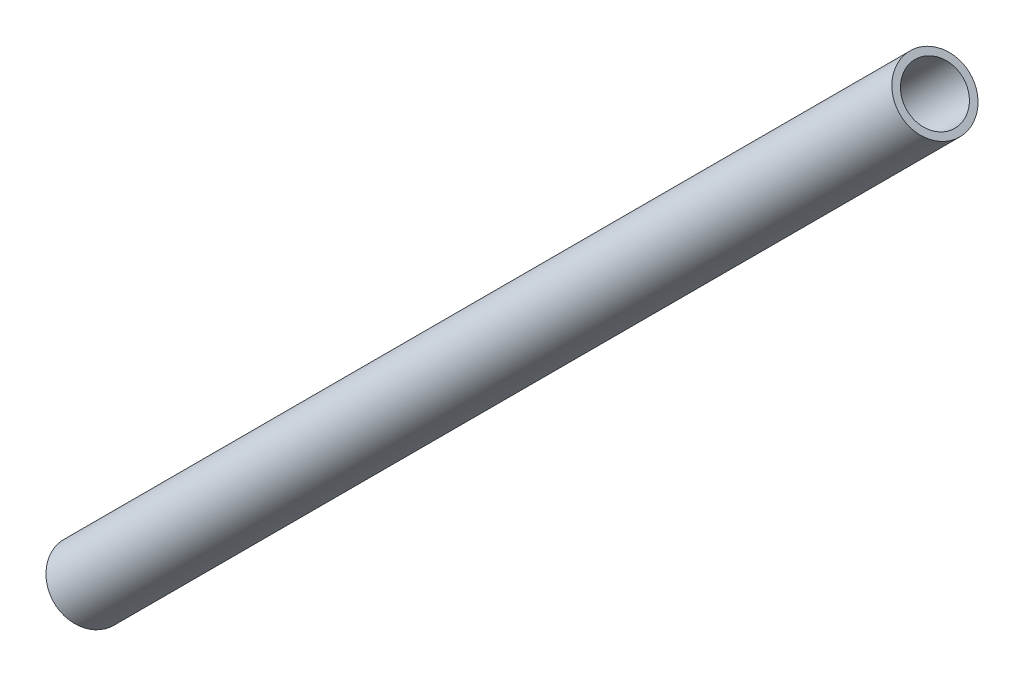
from build123d import *

# Parameters (mm, degrees)
SKETCH2_R           = 5
SKETCH2_R_2         = 4
BOSS_EXTRUDE1_DEPTH = 170


with BuildPart() as part:
    # Sketch2 → Boss-Extrude1 (new body)
    with BuildSketch(Plane(origin=(94.859307055, 94.859307055, 0), x_dir=(0, 0, 1), z_dir=(-0.707106781186544, -0.7071067811865511, 0))):
        with Locations((-10, -38.456734122)):
            Circle(SKETCH2_R)
        with Locations((-10, -38.456734122)):
            Circle(SKETCH2_R_2, mode=Mode.SUBTRACT)
    extrude(amount=BOSS_EXTRUDE1_DEPTH)


solid = part.part
